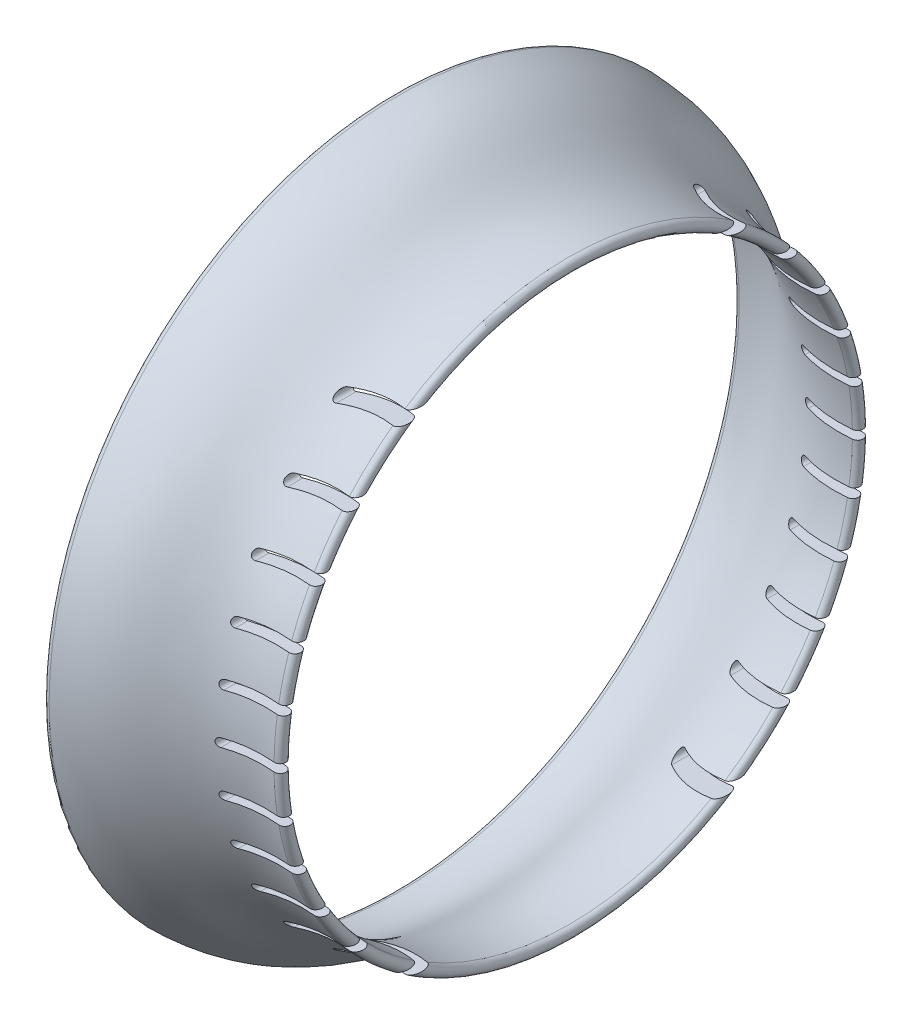
from build123d import *

# Parameters (mm, degrees)
CUT_EXTRUDE4_DEPTH      = 167.519736375
CUT_EXTRUDE4_DEPTH_BACK = 167.519736375


with BuildPart() as part:
    # Sketch1 → Revolve1 (revolve)
    with BuildSketch(Plane.XY):
        with BuildLine():
            ThreePointArc((22.91426372, 86.125219724), (21.870260674, 85.171250312), (22.824230086, 84.127247266))
            add(Edge.make_bspline(
                [(52.824230086, 74.127247266), (39.070257167, 72.883646593), (35.311308467, 81.92302323), (30.03088053, 83.802497581), (22.824230086, 84.127247266)],
                knots=[0, 0, 0, 0, 0, 1, 1, 1, 1, 1], degree=4))
            ThreePointArc((52.824230086, 74.127247266), (53.730117099, 75.213234706), (52.644129658, 76.119121719))
            add(Edge.make_bspline(
                [(52.644129658, 76.119121719), (52.384021001, 76.095603329), (51.855454326, 76.056296071), (50.856957722, 76.014807015), (49.67231687, 76.024496908), (48.355144216, 76.123378854), (46.719045686, 76.356234152), (44.874636671, 76.81122738), (42.248390084, 77.79950581), (39.410546814, 79.386155584), (36.341886069, 81.47503641), (33.317656359, 83.420339059), (30.10359012, 84.941887471), (27.204904026, 85.696447466), (24.788876541, 86.013562425), (23.536309364, 86.097188793), (22.91426372, 86.125219724)],
                knots=[0, 0, 0, 0, 0.015625, 0.03125, 0.0625, 0.09375, 0.125, 0.1875, 0.25, 0.375, 0.5, 0.625, 0.75, 0.875, 0.9375, 1, 1, 1, 1], degree=3))
        make_face()
    revolve(axis=Axis((-45.925301397, 24.127247266, 0), (1, 0, 0)))

    # Sketch2 → Cut-Extrude4 (cut, two sides: drawn at the far end of the back side and taken through both)
    with BuildSketch(Plane.XY.offset(70).offset(-CUT_EXTRUDE4_DEPTH_BACK)):
        with BuildLine():
            Line((44.21222369, 24.869121719), (55.690823691, 24.869121719))
            ThreePointArc((55.690823691, 24.869121719), (56.440823691, 24.119121719), (55.690823691, 23.369121719))
            Line((55.690823691, 23.369121719), (44.21222369, 23.369121719))
            ThreePointArc((44.21222369, 23.369121719), (43.46222369, 24.119121719), (44.21222369, 24.869121719))
        make_face()
        with BuildLine():
            Line((44.21222369, 33.369121719), (55.690823691, 33.369121719))
            ThreePointArc((55.690823691, 33.369121719), (56.440823691, 32.619121719), (55.690823691, 31.869121719))
            Line((55.690823691, 31.869121719), (44.21222369, 31.869121719))
            ThreePointArc((44.21222369, 31.869121719), (43.46222369, 32.619121719), (44.21222369, 33.369121719))
        make_face()
        with BuildLine():
            Line((44.21222369, 41.869121719), (55.690823691, 41.869121719))
            ThreePointArc((55.690823691, 41.869121719), (56.440823691, 41.119121719), (55.690823691, 40.369121719))
            Line((55.690823691, 40.369121719), (44.21222369, 40.369121719))
            ThreePointArc((44.21222369, 40.369121719), (43.46222369, 41.119121719), (44.21222369, 41.869121719))
        make_face()
        with BuildLine():
            Line((44.21222369, 50.369121719), (55.690823691, 50.369121719))
            ThreePointArc((55.690823691, 50.369121719), (56.440823691, 49.619121719), (55.690823691, 48.869121719))
            Line((55.690823691, 48.869121719), (44.21222369, 48.869121719))
            ThreePointArc((44.21222369, 48.869121719), (43.46222369, 49.619121719), (44.21222369, 50.369121719))
        make_face()
        with BuildLine():
            Line((44.21222369, 58.869121719), (55.690823691, 58.869121719))
            ThreePointArc((55.690823691, 58.869121719), (56.440823691, 58.119121719), (55.690823691, 57.369121719))
            Line((55.690823691, 57.369121719), (44.21222369, 57.369121719))
            ThreePointArc((44.21222369, 57.369121719), (43.46222369, 58.119121719), (44.21222369, 58.869121719))
        make_face()
        with BuildLine():
            Line((44.21222369, 67.369121719), (55.690823691, 67.369121719))
            ThreePointArc((55.690823691, 67.369121719), (56.440823691, 66.619121719), (55.690823691, 65.869121719))
            Line((55.690823691, 65.869121719), (44.21222369, 65.869121719))
            ThreePointArc((44.21222369, 65.869121719), (43.46222369, 66.619121719), (44.21222369, 67.369121719))
        make_face()
        with BuildLine():
            Line((44.21222369, 14.869121719), (55.690823691, 14.869121719))
            ThreePointArc((55.690823691, 14.869121719), (56.440823691, 15.619121719), (55.690823691, 16.369121719))
            Line((55.690823691, 16.369121719), (44.21222369, 16.369121719))
            ThreePointArc((44.21222369, 16.369121719), (43.46222369, 15.619121719), (44.21222369, 14.869121719))
        make_face()
        with BuildLine():
            Line((44.21222369, 6.369121719), (55.690823691, 6.369121719))
            ThreePointArc((55.690823691, 6.369121719), (56.440823691, 7.119121719), (55.690823691, 7.869121719))
            Line((55.690823691, 7.869121719), (44.21222369, 7.869121719))
            ThreePointArc((44.21222369, 7.869121719), (43.46222369, 7.119121719), (44.21222369, 6.369121719))
        make_face()
        with BuildLine():
            Line((44.21222369, -2.130878281), (55.690823691, -2.130878281))
            ThreePointArc((55.690823691, -2.130878281), (56.440823691, -1.380878281), (55.690823691, -0.630878281))
            Line((55.690823691, -0.630878281), (44.21222369, -0.630878281))
            ThreePointArc((44.21222369, -0.630878281), (43.46222369, -1.380878281), (44.21222369, -2.130878281))
        make_face()
        with BuildLine():
            Line((44.21222369, -10.630878281), (55.690823691, -10.630878281))
            ThreePointArc((55.690823691, -10.630878281), (56.440823691, -9.880878281), (55.690823691, -9.130878281))
            Line((55.690823691, -9.130878281), (44.21222369, -9.130878281))
            ThreePointArc((44.21222369, -9.130878281), (43.46222369, -9.880878281), (44.21222369, -10.630878281))
        make_face()
        with BuildLine():
            Line((44.21222369, -19.130878281), (55.690823691, -19.130878281))
            ThreePointArc((55.690823691, -19.130878281), (56.440823691, -18.380878281), (55.690823691, -17.630878281))
            Line((55.690823691, -17.630878281), (44.21222369, -17.630878281))
            ThreePointArc((44.21222369, -17.630878281), (43.46222369, -18.380878281), (44.21222369, -19.130878281))
        make_face()
    extrude(amount=CUT_EXTRUDE4_DEPTH + CUT_EXTRUDE4_DEPTH_BACK, mode=Mode.SUBTRACT)


solid = part.part
